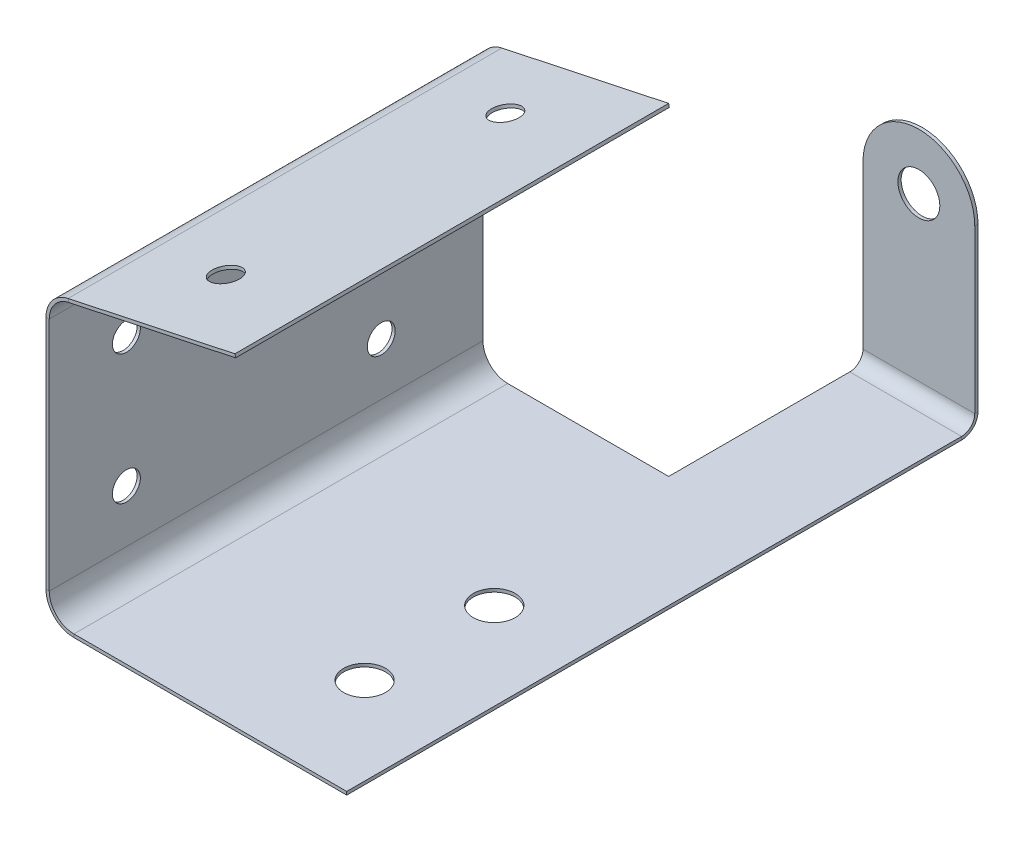
from build123d import *

# Parameters (mm, degrees)
BASE_FLANGE1_DEPTH = 139.7
CUT_EXTRUDE1_START = -139.7
CUT_EXTRUDE1_DEPTH = 41.148
EDGE_FLANGE1_DEPTH = 25.4
FILLET1_RADIUS     = 12.7
FILLET1_LENGTH     = 0.7366
HOLE1_START        = -143.4366
HOLE1_OUTLINE_R    = 4.7625
HOLE1_DEPTH        = 0.7366
SKETCH34_R         = 3.175
CUT_EXTRUDE2_DEPTH = 2.54
SKETCH35_R         = 4.7625
CUT_EXTRUDE3_DEPTH = 2.54
SKETCH36_R         = 3.175
CUT_EXTRUDE4_DEPTH = 2.54


# Read off the part's stored shape, not the designer's step: Cut-Extrude1, Hole1
# Sheet-metal steps are written as plain solids
with BuildPart() as part:
    # Sketch1 → Base-Flange1 (new body)
    with BuildSketch(Plane.XY):
        with BuildLine():
            Line((68.326, 0), (6.35, 0))
            ThreePointArc((6.35, 0), (1.859871939, 1.859871939), (0, 6.35))
            Line((0, 6.35), (0, 59.881871389))
            ThreePointArc((0, 59.881871389), (1.415123145, 63.878055872), (5.029760763, 66.093108654))
            Line((5.029760763, 66.093108654), (42.926, 74.148202966))
            Line((42.926, 74.148202966), (43.079147751, 73.427699444))
            Line((43.079147751, 73.427699444), (5.182908515, 65.372605131))
            ThreePointArc((5.182908515, 65.372605131), (1.98756886, 63.414498472), (0.7366, 59.881871389))
            Line((0.7366, 59.881871389), (0.7366, 6.35))
            ThreePointArc((0.7366, 6.35), (2.380726794, 2.380726794), (6.35, 0.7366))
            Line((6.35, 0.7366), (68.326, 0.7366))
            Line((68.326, 0.7366), (68.326, 0))
        make_face()
    extrude(amount=-BASE_FLANGE1_DEPTH)

    # Cut-Extrude1 outline → Cut-Extrude1 (cut)
    with BuildSketch(Plane.XY.offset(CUT_EXTRUDE1_START)):
        with BuildLine():
            Line((6.35, 0), (42.926, 0))
            Line((42.926, 0), (42.926, 0.7366))
            Line((42.926, 0.7366), (6.35, 0.7366))
            ThreePointArc((6.35, 0.7366), (2.380726794, 2.380726794), (0.7366, 6.35))
            Line((0.7366, 6.35), (0.7366, 59.881871389))
            ThreePointArc((0.7366, 59.881871389), (1.98756886, 63.414498472), (5.182908515, 65.372605131))
            Line((5.182908515, 65.372605131), (43.079147751, 73.427699444))
            Line((43.079147751, 73.427699444), (42.926, 74.148202966))
            Line((42.926, 74.148202966), (5.029760763, 66.093108654))
            ThreePointArc((5.029760763, 66.093108654), (1.415123145, 63.878055872), (0, 59.881871389))
            Line((0, 59.881871389), (0, 6.35))
            ThreePointArc((0, 6.35), (1.859871939, 1.859871939), (6.35, 0))
        make_face()
    extrude(amount=CUT_EXTRUDE1_DEPTH, mode=Mode.SUBTRACT)

    # Edge-Flange1 section (across the edge) → Edge-Flange1 (add)
    with BuildSketch(Plane(origin=(68.326, 0.7366, -142.7), x_dir=(0, 0, 1), z_dir=(-1, 0, 0))):
        with BuildLine():
            Line((-0.7366, 3), (-0.7366, 52.6034))
            Line((-0.7366, 52.6034), (0, 52.6034))
            Line((0, 52.6034), (0, 3))
            ThreePointArc((0, 3), (0.878679656, 0.878679656), (3, 0))
            Line((3, 0), (3, -0.7366))
            ThreePointArc((3, -0.7366), (0.357824801, 0.357824801), (-0.7366, 3))
        make_face()
    extrude(amount=EDGE_FLANGE1_DEPTH)

    # Fillet1: full round fillet: the end face becomes a half cylinder, R = half its width
    fillet1_face = Plane((55.626, 53.34, -143.0683), x_dir=(0, 0, -1), z_dir=(0, 1, 0))  # on the end face: x along it, z out of the body
    fillet1_slab = fillet1_face.offset(-FILLET1_RADIUS / 2) * Box(FILLET1_LENGTH, 2 * FILLET1_RADIUS, FILLET1_RADIUS, mode=Mode.PRIVATE)  # the body's end, R deep
    fillet1_round = Plane((55.626, 40.64, -143.0683), x_dir=(0, 1, 0), z_dir=(0, 0, -1)) * Cylinder(FILLET1_RADIUS, FILLET1_LENGTH, mode=Mode.PRIVATE)  # its axis R under the face
    add(fillet1_slab - fillet1_round, mode=Mode.SUBTRACT)

    # Hole1 outline → Hole1 (cut)
    with BuildSketch(Plane.XY.offset(HOLE1_START)):
        with Locations((55.626, 40.64)):
            Circle(HOLE1_OUTLINE_R)
    extrude(amount=HOLE1_DEPTH, mode=Mode.SUBTRACT)

    # Sketch34 → Cut-Extrude2 (cut)
    with BuildSketch(Plane(origin=(-13.22382174, 62.213189919, 0), x_dir=(0.9781476007338064, 0.20791169081775657, 0), z_dir=(-0.20791169081775657, 0.9781476007338064, 0))):
        with Locations(Location((35.814242159, 19.05, 0), (0, 0, 180))):
            Circle(SKETCH34_R)
        with Locations(Location((35.814242159, 82.55, 0), (0, 0, 180))):
            Circle(SKETCH34_R)
    extrude(amount=-CUT_EXTRUDE2_DEPTH, mode=Mode.SUBTRACT)

    # Sketch35 → Cut-Extrude3 (cut)
    with BuildSketch(Plane(origin=(0, 0.7366, 0), x_dir=(1, 0, 0), z_dir=(0, 1, 0))):
        with Locations(Location((48.514, 23.876, 0), (0, 0, 270))):
            Circle(SKETCH35_R)
        with Locations(Location((48.514, 53.34, 0), (0, 0, 270))):
            Circle(SKETCH35_R)
    extrude(amount=-CUT_EXTRUDE3_DEPTH, mode=Mode.SUBTRACT)

    # Sketch36 → Cut-Extrude4 (cut)
    with BuildSketch(Plane(origin=(0.7366, 0, 0), x_dir=(0, 0, -1), z_dir=(1, 0, 0))):
        with Locations((17.526, 18.288)):
            Circle(SKETCH36_R)
        with Locations((75.438, 18.288)):
            Circle(SKETCH36_R)
        with Locations((17.526, 47.752)):
            Circle(SKETCH36_R)
        with Locations((75.438, 47.752)):
            Circle(SKETCH36_R)
    extrude(amount=-CUT_EXTRUDE4_DEPTH, mode=Mode.SUBTRACT)


solid = part.part
